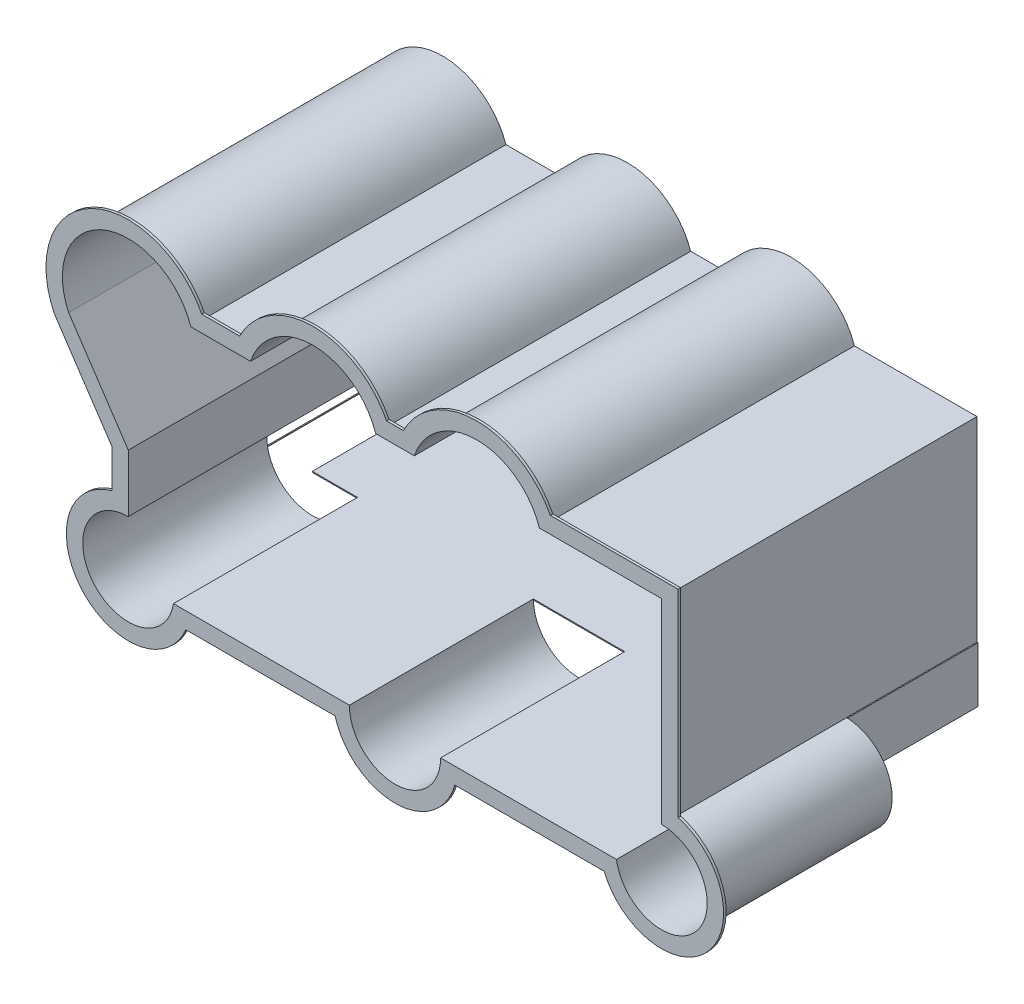
from build123d import *

# Parameters (mm, degrees)
EXTRUDE_THIN2_DEPTH     = 3100
BOSS_EXTRUDE2_DEPTH     = 25
CUT_EXTRUDE1_DEPTH      = 7106.596948885
CUT_EXTRUDE1_DEPTH_BACK = 7106.596948885
SKETCH7_W               = 1405.301830193
SKETCH7_H               = 450
SKETCH8_W               = 5260
SKETCH8_H               = 1285
BOSS_EXTRUDE3_DEPTH     = 10
CUT_EXTRUDE2_OUTLINE_W  = 1285
CUT_EXTRUDE2_OUTLINE_H  = 545
CUT_EXTRUDE2_DEPTH      = 449
SKETCH10_W              = 1285
SKETCH10_H              = 545
BOSS_EXTRUDE4_DEPTH     = 10
CUT_EXTRUDE3_OUTLINE_W  = 1285
CUT_EXTRUDE3_OUTLINE_H  = 541.35782885
CUT_EXTRUDE3_DEPTH      = 449


# Read off the part's stored shape, not the designer's step: Cut-Extrude2, Cut-Extrude3
with BuildPart() as part:
    # body → Extrude-Thin2 (new body)
    with BuildSketch(Plane.XY):
        with BuildLine():
            Line((-3226.904268523, 878.38804319), (-2640, 0.607028525))
            Line((-2640, 0.607028525), (-2640, -554.131540547))
            ThreePointArc((-2640, -554.131540547), (-2978.190785718, -1313.44247389), (-2176.187676846, -1095))
            Line((-2176.187676846, -1095), (-459.891291503, -1095))
            ThreePointArc((-459.891291503, -1095), (0, -1545), (459.891291503, -1095))
            Line((459.891291503, -1095), (2176.187676846, -1095))
            ThreePointArc((2176.187676846, -1095), (2978.190785718, -1313.44247389), (2640, -554.131540547))
            Line((2640, -554.131540547), (2640, 1375))
            Line((2640, 1375), (1431.499198717, 1375))
            ThreePointArc((1431.499198717, 1375), (807.5, 1820), (183.500801283, 1375))
            Line((183.500801283, 1375), (-183.500801283, 1375))
            ThreePointArc((-183.500801283, 1375), (-807.5, 1820), (-1431.499198717, 1375))
            Line((-1431.499198717, 1375), (-2006.000801283, 1375))
            ThreePointArc((-2006.000801283, 1375), (-2878.675275655, 1771.359638247), (-3226.904268523, 878.38804319))
        make_face()
        with BuildLine():
            Line((-3218.17614189, 883.325414771), (-2630, 3.64217115))
            Line((-2630, 3.64217115), (-2630, -564.001111112))
            ThreePointArc((-2630, -564.001111112), (-2971.056689396, -1306.399078725), (-2184.636410132, -1085))
            Line((-2184.636410132, -1085), (-450, -1085))
            ThreePointArc((-450, -1085), (0, -1535), (450, -1085))
            Line((450, -1085), (2184.636410132, -1085))
            ThreePointArc((2184.636410132, -1085), (2971.056689396, -1306.399078725), (2630, -564.001111112))
            Line((2630, -564.001111112), (2630, 1365))
            Line((2630, 1365), (1424.326555849, 1365))
            ThreePointArc((1424.326555849, 1365), (807.5, 1810), (190.673444151, 1365))
            Line((190.673444151, 1365), (-190.673444151, 1365))
            ThreePointArc((-190.673444151, 1365), (-807.5, 1810), (-1424.326555849, 1365))
            Line((-1424.326555849, 1365), (-2013.173444151, 1365))
            ThreePointArc((-2013.173444151, 1365), (-2871.262954199, 1763.566224147), (-3218.17614189, 883.325414771))
        make_face(mode=Mode.SUBTRACT)
    extrude(amount=-EXTRUDE_THIN2_DEPTH)

    # curb → Boss-Extrude2 (add)
    with BuildSketch(Plane.XY):
        with BuildLine():
            Line((-83.169274433, 1527), (83.169274433, 1527))
            ThreePointArc((83.169274433, 1527), (807.5, 1972), (1531.830725567, 1527))
            Line((1531.830725567, 1527), (2792, 1527))
            Line((2792, 1527), (2792, -424.105941715))
            ThreePointArc((2792, -424.105941715), (3087.118903787, -1419.796833395), (2063.089229648, -1247))
            Line((2063.089229648, -1247), (590.169467187, -1247))
            ThreePointArc((590.169467187, -1247), (0, -1697), (-590.169467187, -1247))
            Line((-590.169467187, -1247), (-2063.089229648, -1247))
            ThreePointArc((-2063.089229648, -1247), (-3087.118903787, -1419.796833395), (-2792, -424.105941715))
            Line((-2792, -424.105941715), (-2792, -45.527139379))
            Line((-2792, -45.527139379), (-3359.22062819, 802.81478835))
            ThreePointArc((-3359.22062819, 802.81478835), (-2992.100860231, 1886.792244744), (-1905.669274433, 1527))
            Line((-1905.669274433, 1527), (-1531.830725567, 1527))
            ThreePointArc((-1531.830725567, 1527), (-807.5, 1972), (-83.169274433, 1527))
        make_face()
        with BuildLine():
            ThreePointArc((-2006.000801283, 1375), (-2878.675275655, 1771.359638247), (-3226.904268523, 878.38804319))
            Line((-3226.904268523, 878.38804319), (-2640, 0.607028525))
            Line((-2640, 0.607028525), (-2640, -554.131540547))
            ThreePointArc((-2640, -554.131540547), (-2978.190785718, -1313.44247389), (-2176.187676846, -1095))
            Line((-2176.187676846, -1095), (-459.891291503, -1095))
            ThreePointArc((-459.891291503, -1095), (0, -1545), (459.891291503, -1095))
            Line((459.891291503, -1095), (2176.187676846, -1095))
            ThreePointArc((2176.187676846, -1095), (2978.190785718, -1313.44247389), (2640, -554.131540547))
            Line((2640, -554.131540547), (2640, 1375))
            Line((2640, 1375), (1431.499198717, 1375))
            ThreePointArc((1431.499198717, 1375), (807.5, 1820), (183.500801283, 1375))
            Line((183.500801283, 1375), (-183.500801283, 1375))
            ThreePointArc((-183.500801283, 1375), (-807.5, 1820), (-1431.499198717, 1375))
            Line((-1431.499198717, 1375), (-2006.000801283, 1375))
        make_face(mode=Mode.SUBTRACT)
    extrude(amount=-BOSS_EXTRUDE2_DEPTH)

    # Sketch7 → Cut-Extrude1 (cut, two sides: drawn at the far end of the back side and taken through both)
    with BuildSketch(Plane(origin=(2640, 0, 0), x_dir=(0, 0, -1), z_dir=(1, 0, 0)).offset(-CUT_EXTRUDE1_DEPTH_BACK)):
        with Locations((2517.650915097, -1322)):
            Rectangle(SKETCH7_W, SKETCH7_H)
    extrude(amount=CUT_EXTRUDE1_DEPTH + CUT_EXTRUDE1_DEPTH_BACK, mode=Mode.SUBTRACT)

    # Sketch8 → Boss-Extrude3 (add)
    with BuildSketch(Plane.XZ.offset(1095)):
        with Locations((0, -2457.5)):
            Rectangle(SKETCH8_W, SKETCH8_H)
    extrude(amount=-BOSS_EXTRUDE3_DEPTH)

    # Cut-Extrude2 outline → Cut-Extrude2 (cut)
    with BuildSketch(Plane(origin=(2640, 0, 0), x_dir=(0, 0, -1), z_dir=(1, 0, 0))):
        with Locations((2457.5, -824.5)):
            Rectangle(CUT_EXTRUDE2_OUTLINE_W, CUT_EXTRUDE2_OUTLINE_H)
    extrude(amount=CUT_EXTRUDE2_DEPTH, mode=Mode.SUBTRACT)

    # Sketch10 → Boss-Extrude4 (add)
    with BuildSketch(Plane(origin=(2640, 0, 0), x_dir=(0, 0, -1), z_dir=(1, 0, 0))):
        with Locations((2457.5, -824.5)):
            Rectangle(SKETCH10_W, SKETCH10_H)
    extrude(amount=BOSS_EXTRUDE4_DEPTH)

    # Cut-Extrude3 outline → Cut-Extrude3 (cut)
    with BuildSketch(Plane.ZY.offset(2640)):
        with Locations((-2457.5, -822.678914425)):
            Rectangle(CUT_EXTRUDE3_OUTLINE_W, CUT_EXTRUDE3_OUTLINE_H)
    extrude(amount=CUT_EXTRUDE3_DEPTH, mode=Mode.SUBTRACT)


solid = part.part
